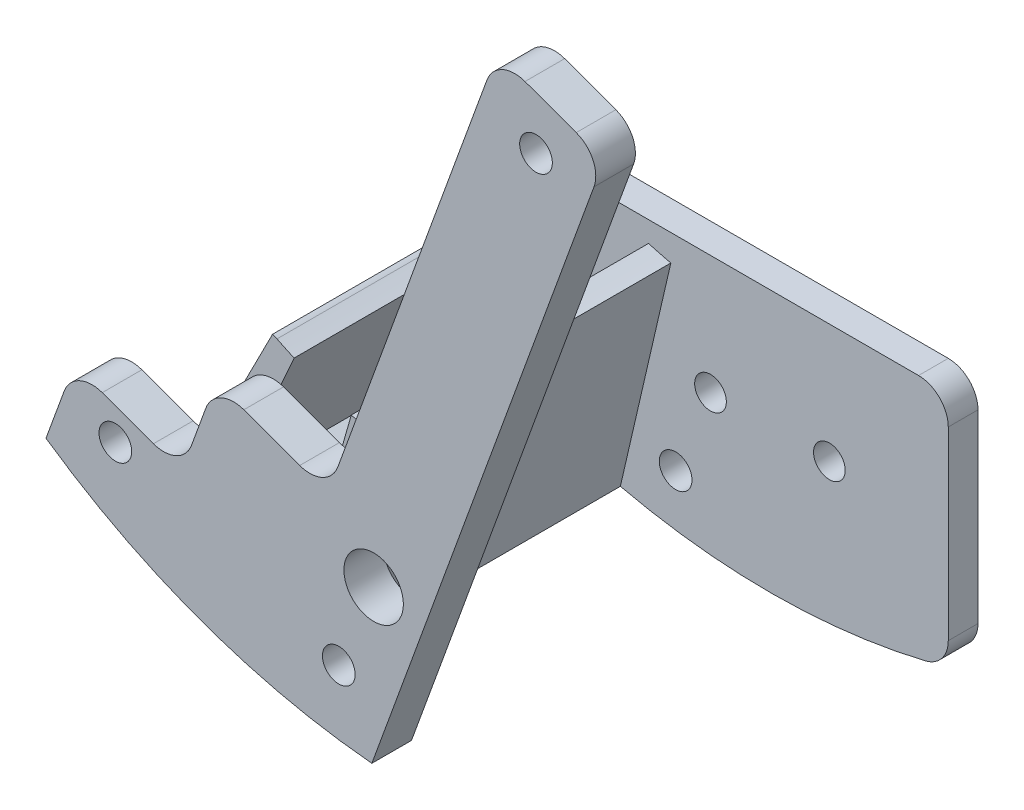
from build123d import *

# Parameters (mm, degrees)
SKETCH_1_R          = 1.600000000000001
SKETCH_1_R_2        = 1.6000000000000019
SKETCH_1_R_3        = 1.5999999999999985
EXTRUDE_1_DEPTH     = 3
EXTRUDE_2_DEPTH     = 30
CUT_EXTRUDE_1_DEPTH = 40
SKETCH_4_R          = 1.6499999999999986
SKETCH_4_R_2        = 1.6499999999999997
EXTRUDE_3_DEPTH     = 4
CUT_EXTRUDE_START   = -3
CUT_EXTRUDE_5_DEPTH = 3
EXTRUDE_4_DEPTH     = 3
FILLET_2_R          = 3
EXTRUDE_5_DEPTH     = 4
SKETCH_10_R         = 2.9999999999999996
CUT_EXTRUDE_6_DEPTH = 4
SKETCH_11_R         = 1.6500000000000008
CUT_EXTRUDE_7_DEPTH = 62.45571715470519


with BuildPart() as part:
    # 草图1 → 凸台-拉伸1 (new body)
    with BuildSketch(Plane.XY):
        with BuildLine():
            Line((-8.023322075989554, -14.631711796201198), (27.976677924010442, -14.631711796201193))
            Line((27.976677924010442, -14.631711796201193), (27.976677924010446, -38.631711796201195))
            Line((27.976677924010446, -38.631711796201195), (-8.023322075989551, -38.6317117962012))
            ThreePointArc((-8.023322075989551, -38.6317117962012), (-43.46930578748299, -14.57230150362017), (-57.14129859782335, 26.027570386525145))
            Line((-57.14129859782335, 26.027570386525145), (-34.48878313976992, 26.027570386525145))
            ThreePointArc((-34.48878313976992, 26.027570386525145), (-27.28963076602897, 1.7706236653637966), (-8.023322075989554, -14.631711796201198))
        make_face()
        with Locations((3.976677924010446, -26.6317117962012)):
            Circle(SKETCH_1_R, mode=Mode.SUBTRACT)
        with Locations(Location((15.976677924010446, -26.6317117962012, 0), (0, 0, 180))):
            Circle(SKETCH_1_R_2, mode=Mode.SUBTRACT)
        with Locations((-42.682604258715905, 20.02757038652514)):
            Circle(SKETCH_1_R_3, mode=Mode.SUBTRACT)
    extrude(amount=EXTRUDE_1_DEPTH)

    # 草图2 → 凸台-拉伸2 (add)
    with BuildSketch(Plane.XY.offset(3)):
        with BuildLine():
            Line((-20.49424577864387, -33.77498458475056), (-10.210218965484446, -13.591445522347069))
            ThreePointArc((-10.210218965484446, -13.591445522347069), (-5.231405442065514, -15.756295254952452), (-0.02587442417285965, -17.298243790895924))
            Line((-0.02587442417285965, -17.298243790895924), (-5.121581660002594, -39.370176745308015))
            ThreePointArc((-5.121581660002594, -39.370176745308015), (-12.979022025715798, -37.042696873124), (-20.49424577864387, -33.77498458475056))
        make_face()
    extrude(amount=EXTRUDE_2_DEPTH)

    # 草图3 → 切除-拉伸1 (cut)
    with BuildSketch(Plane.XY.offset(3)):
        with BuildLine():
            Line((-14.348702760927614, -28.820181203971632), (-7.456511566861831, -13.279984919997544))
            ThreePointArc((-7.456511566861831, -13.279984919997544), (-4.701142282615541, -14.38977235123981), (-1.875728376120071, -15.30668253882269))
            Line((-1.875728376120071, -15.30668253882269), (-6.561563425008877, -31.648131369774166))
            ThreePointArc((-6.561563425008877, -31.648131369774166), (-10.504001434072327, -30.368721805705025), (-14.348702760927614, -28.820181203971632))
        make_face()
    extrude(amount=CUT_EXTRUDE_1_DEPTH, mode=Mode.SUBTRACT)

    # 草图4 → 凸台-拉伸3 (add)
    with BuildSketch(Plane.XY.offset(33)):
        Polygon((-27.87837659400939, -26.811760111104594), (5.010865133497435, -38.782465127502874), (27.24217444966564, 22.297555223581274), (16.435709310627683, 26.230786871826414), (-0.6652978556555434, -20.753844167469087), (-11.941609305086462, -16.649602447561108), (-15.43021476700824, -26.234467179577372), (-26.236679906046202, -22.30123553133223), align=None)
        with Locations((20.36376431871485, 19.48020290794287)):
            Circle(SKETCH_4_R, mode=Mode.SUBTRACT)
        with Locations((0.4581919771611356, -35.20990762179707)):
            Circle(SKETCH_4_R_2, mode=Mode.SUBTRACT)
        with Locations(Location((-22.094430921700695, -27.001424181981108, 0), (0, 0, 180))):
            Circle(SKETCH_4_R, mode=Mode.SUBTRACT)
    extrude(amount=EXTRUDE_3_DEPTH)

    # 草图7 → 切除-拉伸5 (cut)
    with BuildSketch(Plane.XY.offset(3).offset(CUT_EXTRUDE_START)):
        with BuildLine():
            Line((-12.256052607879635, -12.480648485696536), (-23.582310336906296, -32.09830233199053))
            ThreePointArc((-23.582310336906296, -32.09830233199053), (-48.149194794505114, -7.53141787439181), (-57.14129859782335, 26.027570386525152))
            Line((-57.14129859782335, 26.027570386525152), (-34.48878313976992, 26.027570386525145))
            ThreePointArc((-34.48878313976992, 26.027570386525145), (-28.53154094821116, 3.794839854634926), (-12.256052607879635, -12.480648485696536))
        make_face()
    extrude(amount=CUT_EXTRUDE_5_DEPTH, mode=Mode.SUBTRACT)

    # 草图8 → 凸台-拉伸4 (add)
    with BuildSketch(Plane(origin=(0, 0, 0), x_dir=(-1, 0, 0), z_dir=(0, 0, -1))):
        with BuildLine():
            Line((-27.976677924010446, -38.631711796201195), (8.023322075989551, -38.6317117962012))
            ThreePointArc((8.023322075989551, -38.6317117962012), (-9.97667792401045, -41.090406135308655), (-27.976677924010446, -38.631711796201195))
        make_face()
    extrude(amount=-EXTRUDE_4_DEPTH)

    # 圆角2
    fillet_2_edges = [part.edges().sort_by_distance(p)[0] for p in [
        (-26.236679906046202, -22.30123553133223, 35),
    ]]
    fillet(fillet_2_edges, radius=FILLET_2_R)
    fillet_2_2_edges = [part.edges().sort_by_distance(p)[0] for p in [
        (27.24217444966564, 22.297555223581274, 35),
    ]]
    fillet(fillet_2_2_edges, radius=FILLET_2_R)
    fillet_2_3_edges = [part.edges().sort_by_distance(p)[0] for p in [
        (16.435709310627683, 26.230786871826414, 35),
    ]]
    fillet(fillet_2_3_edges, radius=FILLET_2_R)
    fillet_2_4_edges = [part.edges().sort_by_distance(p)[0] for p in [
        (27.976677924010446, -38.631711796201195, 1.5),
    ]]
    fillet(fillet_2_4_edges, radius=FILLET_2_R)
    fillet_2_5_edges = [part.edges().sort_by_distance(p)[0] for p in [
        (-23.5823103369063, -32.09830233199054, 1.5),
    ]]
    fillet(fillet_2_5_edges, radius=FILLET_2_R)
    fillet_2_6_edges = [part.edges().sort_by_distance(p)[0] for p in [
        (-12.256052607879633, -12.480648485696538, 1.5),
    ]]
    fillet(fillet_2_6_edges, radius=FILLET_2_R)
    fillet_2_7_edges = [part.edges().sort_by_distance(p)[0] for p in [
        (27.976677924010442, -14.631711796201193, 1.5),
    ]]
    fillet(fillet_2_7_edges, radius=FILLET_2_R)
    # the kernel refuses this fillet: 3 mm, written as the material it adds along each edge
    with BuildSketch(Plane(origin=(-0.6652978556555434, -20.753844167469087, 33), x_dir=(-0.93969262078591, 0.34202014332566444, 0), z_dir=(0, 0, 1))) as fillet_2_8_piece_1:
        with BuildLine():
            CenterArc((FILLET_2_R, -FILLET_2_R), FILLET_2_R, 89.99999999999999, 90.00000000000001)
            Line((5e-17, -FILLET_2_R), (-FILLET_2_R * 0.02, -FILLET_2_R))
            Line((-FILLET_2_R * 0.02, -FILLET_2_R), (-FILLET_2_R * 0.02, FILLET_2_R * 0.02))
            Line((-FILLET_2_R * 0.02, FILLET_2_R * 0.02), (FILLET_2_R, FILLET_2_R * 0.02))
            Line((FILLET_2_R, FILLET_2_R * 0.02), (FILLET_2_R, -5e-17))
        make_face()
    extrude(amount=4)
    # the kernel refuses this fillet: 3 mm, written as the material it takes off along each edge
    with BuildSketch(Plane(origin=(-11.941609305086462, -16.649602447561108, 33), x_dir=(0.9396926207859099, -0.3420201433256647, 0), z_dir=(0, 0, 1))) as fillet_2_9_piece_1:
        with BuildLine():
            CenterArc((FILLET_2_R, -FILLET_2_R), FILLET_2_R, 89.99999999999997, 90)
            Line((-2.84e-15, -FILLET_2_R), (-FILLET_2_R * 0.02, -FILLET_2_R))
            Line((-FILLET_2_R * 0.02, -FILLET_2_R), (-FILLET_2_R * 0.02, FILLET_2_R * 0.02))
            Line((-FILLET_2_R * 0.02, FILLET_2_R * 0.02), (FILLET_2_R, FILLET_2_R * 0.02))
            Line((FILLET_2_R, FILLET_2_R * 0.02), (FILLET_2_R, -5e-17))
        make_face()
    extrude(amount=11.5, mode=Mode.SUBTRACT)
    # the kernel refuses this fillet: 3 mm, written as the material it adds along each edge
    with BuildSketch(Plane(origin=(-15.43021476700824, -26.234467179577372, 33), x_dir=(0.34202014332566544, 0.9396926207859095, 0), z_dir=(0, 0, 1))) as fillet_2_10_piece_1:
        with BuildLine():
            CenterArc((FILLET_2_R, FILLET_2_R), FILLET_2_R, 180.00000000000006, 90)
            Line((-5.63e-15, FILLET_2_R), (-FILLET_2_R * 0.02, FILLET_2_R))
            Line((-FILLET_2_R * 0.02, FILLET_2_R), (-FILLET_2_R * 0.02, -FILLET_2_R * 0.02))
            Line((-FILLET_2_R * 0.02, -FILLET_2_R * 0.02), (FILLET_2_R, -FILLET_2_R * 0.02))
            Line((FILLET_2_R, -FILLET_2_R * 0.02), (FILLET_2_R, 9e-17))
        make_face()
    extrude(amount=4)

    # 草图9 → 凸台-拉伸5 (add)
    with BuildSketch(Plane.XY.offset(37.00000000000001)):
        with BuildLine():
            Line((-27.87837659400939, -26.811760111104594), (-29.094175630850113, -30.152140511419198))
            ThreePointArc((-29.094175630850113, -30.152140511419198), (-13.427826993623084, -38.27577838818826), (3.79506609665671, -42.12284552781748))
            Line((3.79506609665671, -42.12284552781748), (5.010865133497435, -38.782465127502874))
            Line((5.010865133497435, -38.782465127502874), (-27.87837659400939, -26.811760111104594))
        make_face()
    extrude(amount=-EXTRUDE_5_DEPTH)

    # 草图10 → 切除-拉伸6 (cut)
    with BuildSketch(Plane.XY.offset(37.00000000000001)):
        with Locations((3.976677924010446, -26.6317117962012)):
            Circle(SKETCH_10_R)
    extrude(amount=-CUT_EXTRUDE_6_DEPTH, mode=Mode.SUBTRACT)

    # 草图11 → 切除-拉伸7 (cut, through all)
    with BuildSketch(Plane.XY.offset(3)):
        with Locations((0.4581919771611356, -35.20990762179707)):
            Circle(SKETCH_11_R)
    extrude(amount=-CUT_EXTRUDE_7_DEPTH, mode=Mode.SUBTRACT)


solid = part.part
